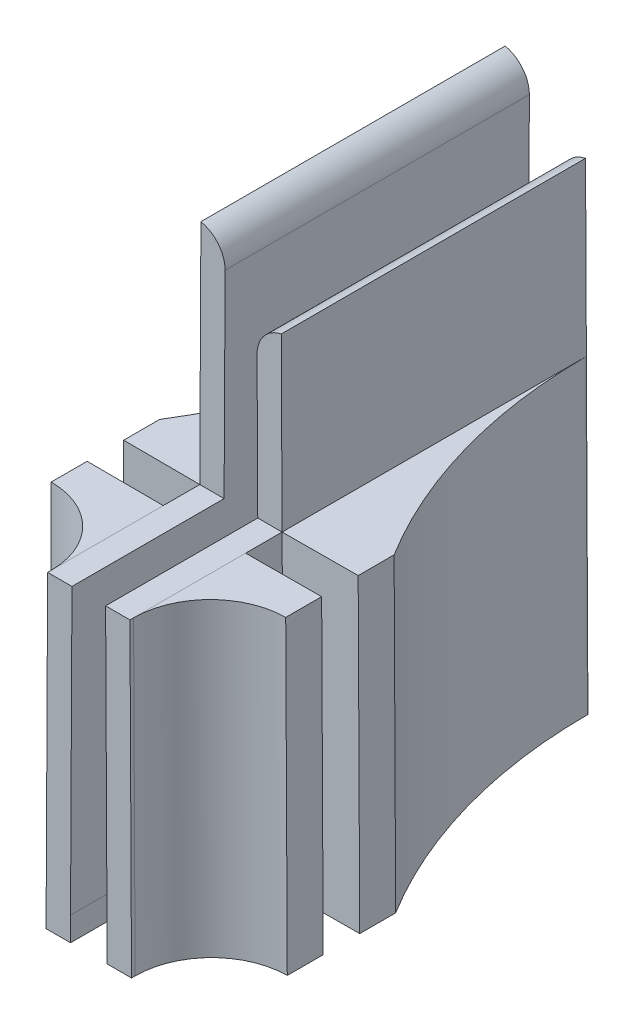
from build123d import *

# Parameters (mm, degrees)
BOSS_EXTRUDE1_DEPTH = 38.1
FILLET1_R           = 2.54
SKETCH2_W           = 3.048
SKETCH2_H           = 2
SKETCH2_W_2         = 6.87382658
SKETCH2_H_2         = 19.05
CUT_EXTRUDE1_DEPTH  = 12.7
SKETCH3_W           = 3
SKETCH3_H           = 25.822446998
BOSS_EXTRUDE2_DEPTH = 6.35
SKETCH4_W           = 3
SKETCH4_H           = 25.822446998
BOSS_EXTRUDE4_DEPTH = 6.35
FILLET3_R           = 42.545
FILLET4_R           = 6.35


# Some blends are built 0.0001 mm under size
with BuildPart() as part:
    # Sketch1 → Boss-Extrude1 (new body)
    with BuildSketch(Plane.XY):
        Polygon((-1.3335, 40.099523747), (-3.3654746, 40.109683747), (-3.566025525, 0), (3.566025525, 0), (3.3654746, 40.109683747), (1.3335, 40.099523747), (1.524, 2), (-1.524, 2), align=None)
        Polygon((-1.3096875, 44.861964215), (-1.3335, 40.099523747), (-3.3654746, 40.109683747), (-3.3416621, 44.872124215), align=None)
    extrude(amount=BOSS_EXTRUDE1_DEPTH)

    # Fillet1
    # the kernel refuses this fillet: 2.54 mm, written as the material it takes off along each edge
    with BuildSketch(Plane(origin=(1.3335, 40.099523747, -6.221703947), x_dir=(0.005000000000000079, -0.999987499921874, 0), z_dir=(0, 0, 1))) as fillet1_piece_1:
        with BuildLine():
            CenterArc((2.488681579, 2.54), FILLET1_R, 191.536959033, 78.463040967)
            Line((0, 2.032), (-0.049773632, 2.02184))
            ThreePointArc((-0.049773632, 2.02184), (-0.0508, 1.016), (-0.0508, 0))
            Line((-0.0508, 0), (0, -0.0508))
            Line((0, -0.0508), (2.488681579, -0.0508))
            Line((2.488681579, -0.0508), (2.488681579, 0))
        make_face()
    extrude(amount=50.543407893, mode=Mode.SUBTRACT)
    with BuildSketch(Plane(origin=(-1.3096875, 44.861964215, -6.221703947), x_dir=(-0.005000000000000297, -0.999987499921874, 0), z_dir=(0, 0, 1))) as fillet1_piece_2:
        with BuildLine():
            CenterArc((2.488681579, -2.54), FILLET1_R, 90, 78.463040967)
            Line((0, -2.032), (-0.049773632, -2.02184))
            ThreePointArc((-0.049773632, -2.02184), (-0.0508, -1.016), (-0.0508, 0))
            Line((-0.0508, 0), (0, 0.0508))
            Line((0, 0.0508), (2.488681579, 0.0508))
            Line((2.488681579, 0.0508), (2.488681579, 0))
        make_face()
    extrude(amount=50.543407893, mode=Mode.SUBTRACT)

    # Sketch2 → Cut-Extrude1 (cut)
    with BuildSketch(Plane.XY.offset(38.1)):
        with Locations((0, 1)):
            Rectangle(SKETCH2_W, SKETCH2_H)
        with Locations((0, 35.347124215)):
            Rectangle(SKETCH2_W_2, SKETCH2_H_2)
    extrude(amount=-CUT_EXTRUDE1_DEPTH, mode=Mode.SUBTRACT)

    # Sketch3 → Boss-Extrude2 (add)
    with BuildSketch(Plane(origin=(3.565936375, 0.017829905, 0), x_dir=(0, 0, -1), z_dir=(0.9999874999218742, 0.004999999999999631, 0))):
        with Locations((-23.9, 12.893393371)):
            Rectangle(SKETCH3_W, SKETCH3_H)
        with Locations((-29.948, 12.893393371)):
            Rectangle(SKETCH3_W, SKETCH3_H)
    extrude(amount=BOSS_EXTRUDE2_DEPTH)

    # Sketch4 → Boss-Extrude4 (add)
    with BuildSketch(Plane(origin=(-3.565936375, 0.017829905, 0), x_dir=(0, 0, 1), z_dir=(-0.9999874999218742, 0.004999999999999631, 0))):
        with Locations((29.948, 12.893393371)):
            Rectangle(SKETCH4_W, SKETCH4_H)
        with Locations((23.9, 12.893393371)):
            Rectangle(SKETCH4_W, SKETCH4_H)
    extrude(amount=BOSS_EXTRUDE4_DEPTH)

    # Fillet3
    # the kernel refuses this fillet: 42.545 mm, written as the material it adds along each edge
    with BuildSketch(Plane(origin=(3.43691329, 25.822124215, 22.4), x_dir=(0, 0, -1), z_dir=(0.004999999999999631, -0.9999874999218742, 0))) as fillet3_piece_1:
        with BuildLine():
            CenterArc((22.360657414, 42.545), FILLET3_R, 238.292930672, 31.707069328)
            Line((0, 6.35), (0, 0))
            Line((0, 0), (22.360657414, 0))
        make_face()
    extrude(amount=25.822446998)
    with BuildSketch(Plane(origin=(-3.43691329, 25.822124215, 22.4), x_dir=(0, 0, -1), z_dir=(-0.004999999999999631, -0.9999874999218742, 0))) as fillet3_piece_2:
        with BuildLine():
            CenterArc((22.360657414, -42.545), FILLET3_R, 90, 31.707069328)
            Line((0, -6.35), (0, 0))
            Line((0, 0), (22.360657414, 0))
        make_face()
    extrude(amount=25.822446998)

    # Fillet4
    fillet4_edges = [part.edges().sort_by_distance(p)[0] for p in [
        (3.501469408, 12.911062108, 31.448),
        (-3.501469408, 12.911062108, 31.448),
    ]]
    fillet(fillet4_edges, radius=FILLET4_R - 0.0001)  # a hair under: the kernel refuses the full size


solid = part.part
